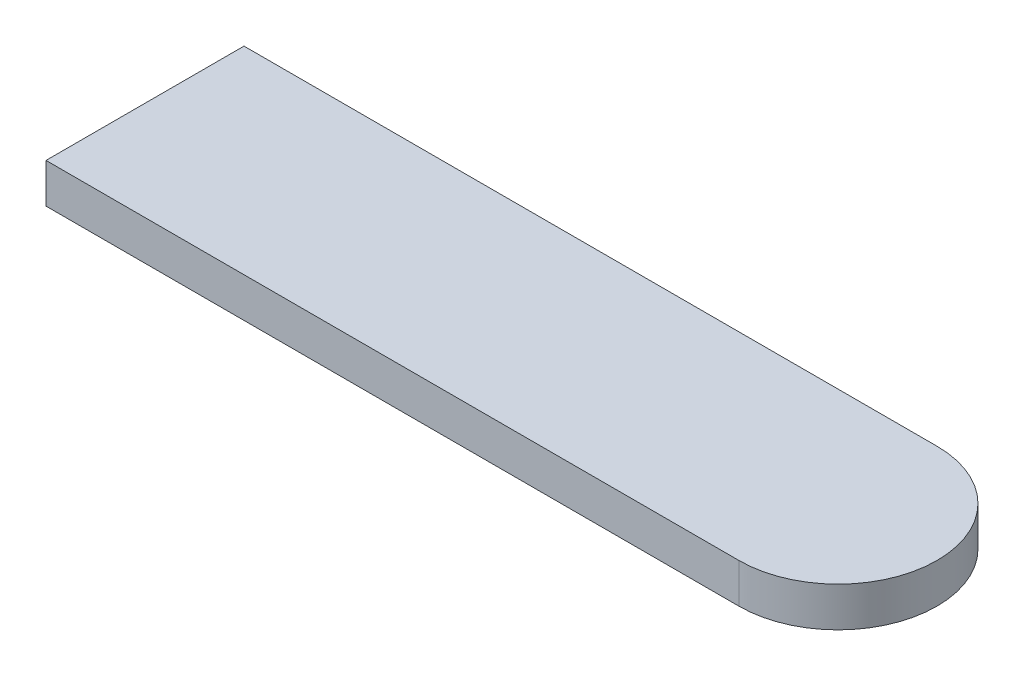
from build123d import *

# Parameters (mm, degrees)
BOSS_EXTRU_1_DEPTH = 10


with BuildPart() as part:
    # Esquisse1 → Boss.-Extru.1 (new body)
    with BuildSketch(Plane(origin=(0, 0, 0), x_dir=(1, 0, 0), z_dir=(0, 1, 0))):
        with BuildLine():
            Line((-100, -25), (75, -25))
            ThreePointArc((75, -25), (100, 0), (75, 25))
            Line((75, 25), (-100, 25))
            Line((-100, 25), (-100, -25))
        make_face()
    extrude(amount=BOSS_EXTRU_1_DEPTH)


solid = part.part
